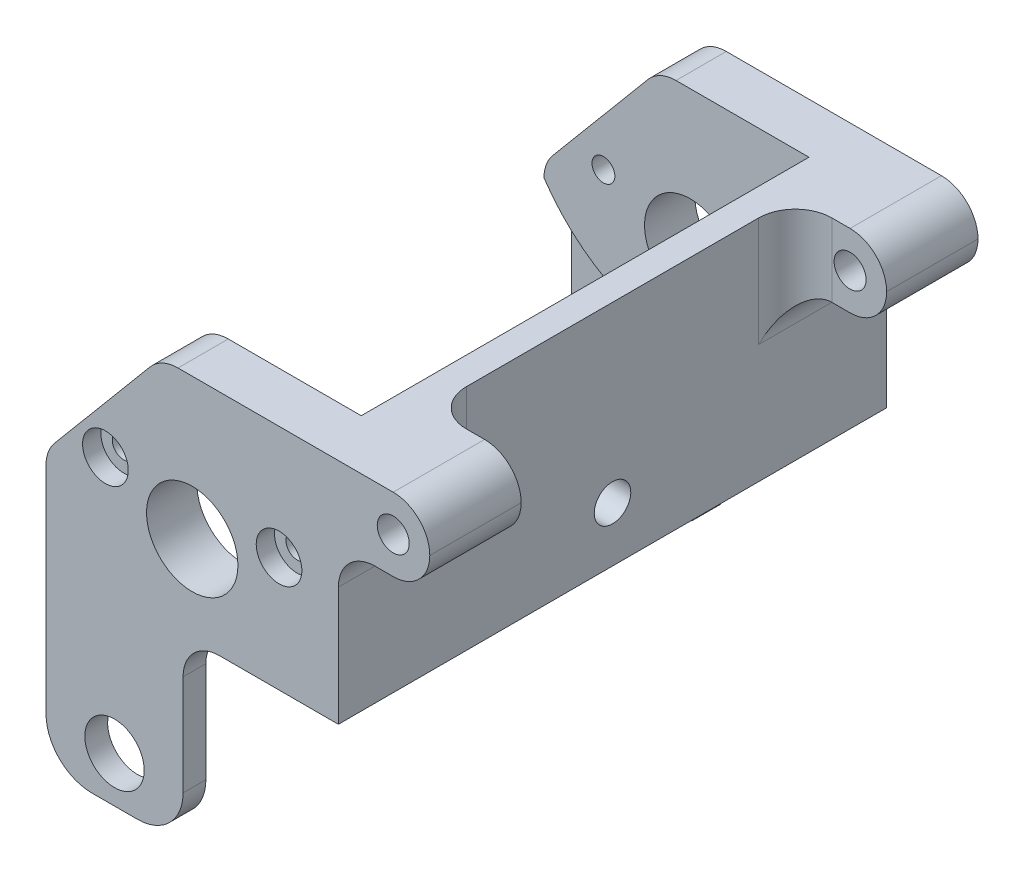
from build123d import *

# Parameters (mm, degrees)
BOSS_EXTRUDE1_DEPTH      = 30
BOSS_EXTRUDE1_DEPTH_BACK = 30
SKETCH2_R                = 3.25
SKETCH2_R_2              = 1.25
SKETCH2_R_3              = 5
SKETCH3_W                = 58
SKETCH3_H                = 55
CUT_EXTRUDE1_DEPTH       = 60.373815778
SKETCH4_W                = 10
SKETCH4_H                = 8
BOSS_EXTRUDE2_DEPTH      = 10
FILLET1_R                = 4
SKETCH5_R                = 1.75
CUT_EXTRUDE2_DEPTH       = 76.599272483
FILLET1_OF_MIRROR1_R     = 4
FILLET2_R                = 4
SKETCH6_R                = 1.25
SKETCH6_R_2              = 5
BOSS_EXTRUDE3_DEPTH      = 3
SKETCH7_R                = 2.5
CUT_EXTRUDE3_DEPTH       = 2
SKETCH8_R                = 2
CUT_EXTRUDE4_DEPTH       = 62.36774397


with BuildPart() as part:
    # Sketch2 → Boss-Extrude1 (new, two sides: drawn at the far end of the back side and taken through both)
    with BuildSketch(Plane.XY.offset(-BOSS_EXTRUDE1_DEPTH_BACK)):
        with BuildLine():
            Line((-7.5, 5), (-7.5, 30))
            Line((-7.5, 30), (5.086494468, 45))
            Line((5.086494468, 45), (24.5, 45))
            Line((24.5, 45), (24.5, 20))
            Line((24.5, 20), (7.5, 20))
            Line((7.5, 20), (7.5, 5))
            ThreePointArc((7.5, 5), (6.035533906, 1.464466094), (2.5, 0))
            Line((2.5, 0), (-2.5, 0))
            ThreePointArc((-2.5, 0), (-6.035533906, 1.464466094), (-7.5, 5))
        make_face()
        with Locations((0, 5)):
            Circle(SKETCH2_R, mode=Mode.SUBTRACT)
        with Locations((18.004770913, 32.569673822)):
            Circle(SKETCH2_R_2, mode=Mode.SUBTRACT)
        with Locations((-0.995229087, 32.569673822)):
            Circle(SKETCH2_R_2, mode=Mode.SUBTRACT)
        with Locations((8.504770913, 29.569673822)):
            Circle(SKETCH2_R_3, mode=Mode.SUBTRACT)
    extrude(amount=BOSS_EXTRUDE1_DEPTH + BOSS_EXTRUDE1_DEPTH_BACK)

    # Sketch3 → Cut-Extrude1 (cut, through all)
    with BuildSketch(Plane(origin=(0, 45, 0), x_dir=(1, 0, 0), z_dir=(0, 1, 0))):
        with Locations((-7.5, 0)):
            Rectangle(SKETCH3_W, SKETCH3_H)
    extrude(amount=-CUT_EXTRUDE1_DEPTH, mode=Mode.SUBTRACT)

    # Sketch4 → Boss-Extrude2 (add)
    with BuildSketch(Plane(origin=(24.5, 0, 0), x_dir=(0, 0, -1), z_dir=(1, 0, 0))):
        with Locations((-25, 41)):
            Rectangle(SKETCH4_W, SKETCH4_H)
    boss_extrude2 = extrude(amount=BOSS_EXTRUDE2_DEPTH)

    # Fillet1
    fillet1_edges = [part.edges().sort_by_distance(p)[0] for p in [
        (34.5, 37, 25),
        (34.5, 45, 25),
    ]]
    fillet(fillet1_edges, radius=FILLET1_R - 0.0001)  # a hair under: the kernel refuses the full size

    # Sketch5 → Cut-Extrude2 (cut, through all)
    with BuildSketch(Plane(origin=(0, 0, 20), x_dir=(-1, 0, 0), z_dir=(0, 0, -1))):
        with Locations((-30.5, 41)):
            Circle(SKETCH5_R)
    cut_extrude2 = extrude(amount=-CUT_EXTRUDE2_DEPTH, mode=Mode.SUBTRACT)

    # Mirror1: Boss-Extrude2, Cut-Extrude2 across plane
    add(boss_extrude2.mirror(Plane.XY))
    add(cut_extrude2.mirror(Plane.XY), mode=Mode.SUBTRACT)

    # Fillet1 of Mirror1
    fillet1_of_mirror1_edges = [part.edges().sort_by_distance(p)[0] for p in [
        (34.5, 37, -25),
        (34.5, 45, -25),
    ]]
    fillet(fillet1_of_mirror1_edges, radius=FILLET1_OF_MIRROR1_R - 0.0001)  # a hair under: the kernel refuses the full size

    # Fillet2
    fillet2_edges = [part.edges().sort_by_distance(p)[0] for p in [
        (24.5, 37, 25),
        (24.5, 41, 20),
        (24.5, 37, -25),
        (24.5, 41, -20),
        (5.086494468, 45, -28.75),
        (7.5, 20, -28.75),
        (-7.5, 30, -28.75),
        (-7.5, 30, 28.75),
        (7.5, 20, 28.75),
        (5.086494468, 45, 28.75),
    ]]
    fillet(fillet2_edges, radius=FILLET2_R)

    # Sketch6 → Boss-Extrude3 (add)
    with BuildSketch(Plane.XY.offset(-27.5)):
        with BuildLine():
            Line((21.5, 45), (6.9517251, 45))
            ThreePointArc((6.9517251, 45), (5.261252053, 44.625231148), (3.887547328, 43.571150439))
            Line((3.887547328, 43.571150439), (-6.564177772, 31.115269502))
            ThreePointArc((-6.564177772, 31.115269502), (-7.258770483, 29.912199636), (-7.5, 28.544119063))
            ThreePointArc((-7.5, 28.544119063), (0.776489044, 21.551274863), (11.5, 20))
            Line((11.5, 20), (21.5, 20))
            Line((21.5, 20), (21.5, 45))
        make_face()
        with Locations((18.004770913, 32.569673822)):
            Circle(SKETCH6_R, mode=Mode.SUBTRACT)
        with Locations((8.504770913, 29.569673822)):
            Circle(SKETCH6_R_2, mode=Mode.SUBTRACT)
        with Locations((-0.995229087, 32.569673822)):
            Circle(SKETCH6_R, mode=Mode.SUBTRACT)
    boss_extrude3 = extrude(amount=BOSS_EXTRUDE3_DEPTH)

    # Sketch7 → Cut-Extrude3 (cut)
    with BuildSketch(Plane(origin=(0, 0, -30), x_dir=(-1, 0, 0), z_dir=(0, 0, -1))):
        with Locations((-18.004770913, 32.569673822)):
            Circle(SKETCH7_R)
        with Locations((0.995229087, 32.569673822)):
            Circle(SKETCH7_R)
    cut_extrude3 = extrude(amount=-CUT_EXTRUDE3_DEPTH, mode=Mode.SUBTRACT)

    # Mirror2: Boss-Extrude3, Cut-Extrude3 across plane
    add(boss_extrude3.mirror(Plane.XY))
    add(cut_extrude3.mirror(Plane.XY), mode=Mode.SUBTRACT)

    # Sketch8 → Cut-Extrude4 (cut, through all)
    with BuildSketch(Plane.ZY.offset(-21.5)):
        with Locations((0, 26)):
            Circle(SKETCH8_R)
    extrude(amount=-CUT_EXTRUDE4_DEPTH, mode=Mode.SUBTRACT)


solid = part.part
